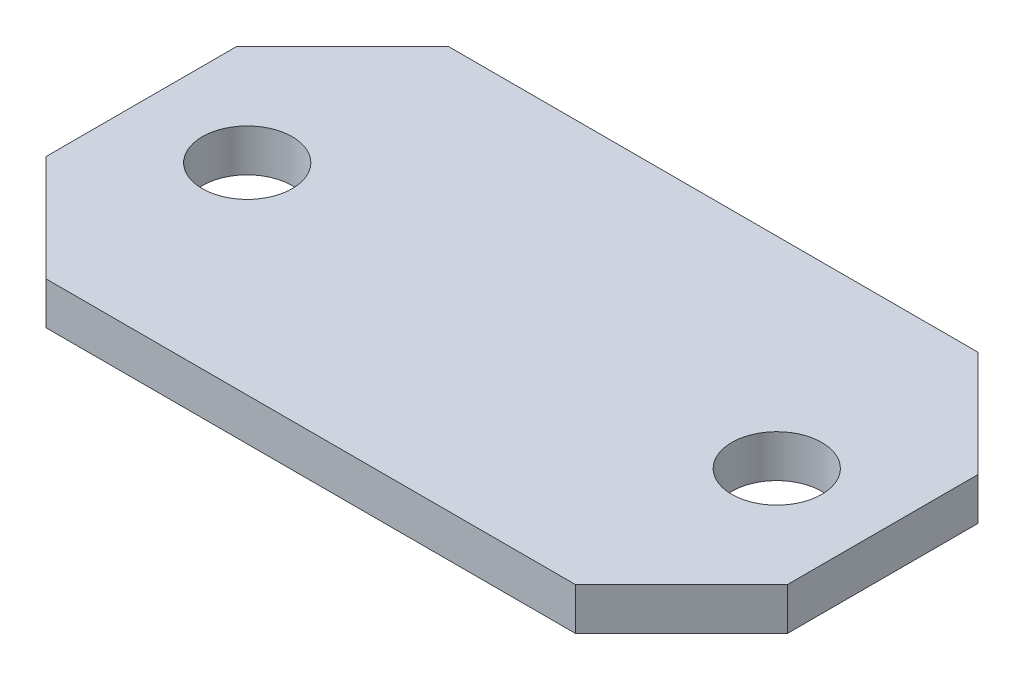
from build123d import *

# Parameters (mm, degrees)
SZKIC1_R                    = 4.25
DODANIE_WYCI_GNI_CIE1_DEPTH = 4


with BuildPart() as part:
    # Szkic1 → Dodanie-wyciągnięcie1 (new body)
    with BuildSketch(Plane(origin=(0, 0, 0), x_dir=(1, 0, 0), z_dir=(0, 1, 0))):
        Polygon((35, -9), (35, 9), (25, 19), (-25, 19), (-35, 9), (-35, -9), (-25, -19), (25, -19), align=None)
        with Locations((25, 0)):
            Circle(SZKIC1_R, mode=Mode.SUBTRACT)
        with Locations((-25, 0)):
            Circle(SZKIC1_R, mode=Mode.SUBTRACT)
    extrude(amount=DODANIE_WYCI_GNI_CIE1_DEPTH)


solid = part.part
